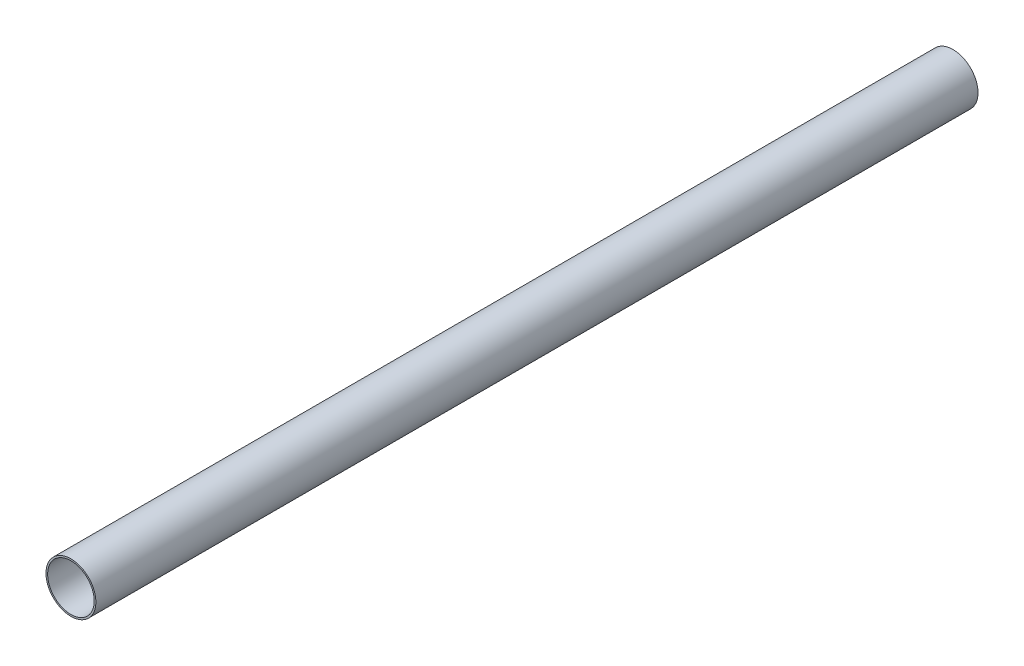
from build123d import *

# Parameters (mm, degrees)
SKETCH_1_R      = 15
SKETCH_1_R_2    = 14
EXTRUDE_1_DEPTH = 265


with BuildPart() as part:
    # Эскиз1 → Бобышка-Вытянуть1 (new, symmetric)
    with BuildSketch(Plane.XY):
        Circle(SKETCH_1_R)
        Circle(SKETCH_1_R_2, mode=Mode.SUBTRACT)
    extrude(amount=EXTRUDE_1_DEPTH, both=True)


solid = part.part
